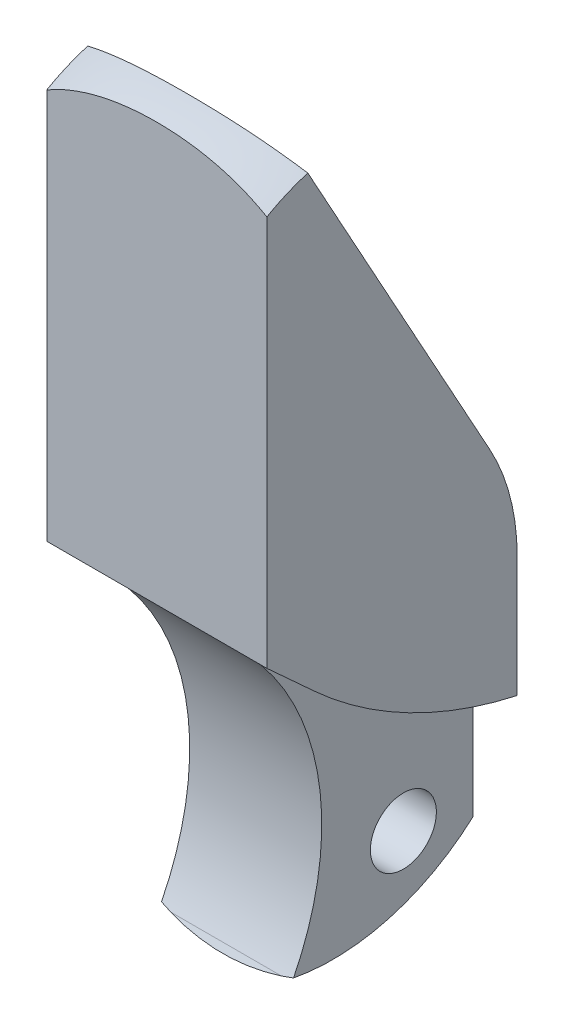
from build123d import *

# Parameters (mm, degrees)
SKETCH1_R           = 10
EXTRUDE1_DEPTH      = 35
FILLET1_R           = 10
FILLET_1_R          = 8
SKETCH2_W           = 7.672344266
SKETCH2_H           = 13.422166089
EXTRUDE2_DEPTH      = 20
SKETCH5_W           = 6.488658855
SKETCH5_H           = 20.959398048
EXTRUDE4_DEPTH      = 38.749172176
SKETCH7_W           = 24.373627343
SKETCH7_H           = 7.918162835
SKETCH7_H_2         = 6.543162835
EXTRUDE6_DEPTH      = 46
SKETCH10_R          = 1.5
CUT_EXTRUDE2_DEPTH  = 37.464237757
CUT_EXTRUDE3_DEPTH  = 37.954575301
FILLET2_START       = -3
FILLET2_OUTLINE_R   = 1.5
FILLET2_DEPTH       = 6
FILLET3_R           = 20
CUT_EXTRUDE_1_DEPTH = 37.954575301
FILLET_2_R          = 10


with BuildPart() as part:
    # Sketch1 → Extrude1 (new body)
    with BuildSketch(Plane(origin=(0, 0, 0), x_dir=(1, 0, 0), z_dir=(0, 1, 0))):
        with Locations(Location((0, 0, 0), (0, 0, 270))):
            Circle(SKETCH1_R)
    extrude(amount=EXTRUDE1_DEPTH)

    # Fillet1
    fillet1_edges = [part.edges().sort_by_distance(p)[0] for p in [
        (0, 0, -10),
    ]]
    fillet(fillet1_edges, radius=FILLET1_R)

    # Скругление1
    fillet_1_edges = [part.edges().sort_by_distance(p)[0] for p in [
        (0, 35, -10),
    ]]
    fillet(fillet_1_edges, radius=FILLET_1_R)

    # Sketch2 → Extrude2 (cut, symmetric)
    with BuildSketch(Plane.XY):
        with Locations((6.836172133, 1.953557325)):
            Rectangle(SKETCH2_W, SKETCH2_H)
        with Locations((-6.836172133, 1.953557325)):
            Rectangle(SKETCH2_W, SKETCH2_H)
    extrude(amount=EXTRUDE2_DEPTH, both=True, mode=Mode.SUBTRACT)

    # Sketch5 → Extrude4 (cut, through all)
    with BuildSketch(Plane(origin=(0, 0, 0), x_dir=(1, 0, 0), z_dir=(0, 1, 0))):
        with Locations((8.244329428, 0.450601309)):
            Rectangle(SKETCH5_W, SKETCH5_H)
        with Locations((-8.244329428, 0.450601309)):
            Rectangle(SKETCH5_W, SKETCH5_H)
    extrude(amount=EXTRUDE4_DEPTH, mode=Mode.SUBTRACT)

    # Sketch7 → Extrude6 (cut, symmetric)
    with BuildSketch(Plane(origin=(0, 0, 0), x_dir=(1, 0, 0), z_dir=(0, 1, 0))):
        with Locations((-0.125613483, -8.959081418)):
            Rectangle(SKETCH7_W, SKETCH7_H)
        with Locations((-0.125613483, 9.646581418)):
            Rectangle(SKETCH7_W, SKETCH7_H_2)
    extrude(amount=EXTRUDE6_DEPTH, both=True, mode=Mode.SUBTRACT)

    # Sketch10 → Cut-Extrude2 (cut, through all)
    with BuildSketch(Plane(origin=(3, 0, 0), x_dir=(0, 0, -1), z_dir=(1, 0, 0))):
        with Locations(Location((3.202782465, 3.918341245, 0), (0, 0, 90))):
            Circle(SKETCH10_R)
    extrude(amount=-CUT_EXTRUDE2_DEPTH, mode=Mode.SUBTRACT)

    # Sketch12 → Cut-Extrude3 (cut, through all)
    with BuildSketch(Plane(origin=(5, 0, 0), x_dir=(0, 0, -1), z_dir=(1, 0, 0))):
        Polygon((-5, 15.421884283), (2.380521482, 8.664640369), (-3.375305401, -2.43292564), (-5, -2.43292564), align=None)
    extrude(amount=-CUT_EXTRUDE3_DEPTH, mode=Mode.SUBTRACT)

    # Fillet2: read off the stored shape, not the designer's step
    # Fillet2 outline → Fillet2 (add)
    with BuildSketch(Plane.YZ.offset(FILLET2_START)):
        with BuildLine():
            ThreePointArc((0.62964824, 1.787878044), (0.810500421, -2.559901853), (2.903566036, -6.375))
            Line((2.903566036, -6.375), (8.664640369, -6.375))
            Line((8.664640369, -6.375), (8.664640369, -2.380521482))
            Line((8.664640369, -2.380521482), (14.875593683, 4.403320413))
            ThreePointArc((14.875593683, 4.403320413), (8.191715719, 0.703912056), (0.62964824, 1.787878044))
        make_face()
        with Locations((3.918341245, -3.202782465)):
            Circle(FILLET2_OUTLINE_R, mode=Mode.SUBTRACT)
    extrude(amount=FILLET2_DEPTH)

    # Fillet3
    # the kernel refuses this fillet: 20 mm, written as the material it takes off along each edge
    with BuildSketch(Plane(origin=(14.71184435, 8.664640369, -2.380521482), x_dir=(0, 0.6752773616828561, 0.7375638852320802), z_dir=(-1, 0, 0))) as fillet3_piece_1_section:
        with BuildLine():
            CenterArc((7.08473774, 20), FILLET3_R, 239.897661879, 30.102338121)
            Line((-2.946183095, 2.697380915), (-3.146801512, 2.351328533))
            ThreePointArc((-3.146801512, 2.351328533), (-1.743202492, 1.053664903), (-0.270110945, -0.295025554))
            Line((-0.270110945, -0.295025554), (0, -0.4))
            Line((0, -0.4), (7.08473774, -0.4))
            Line((7.08473774, -0.4), (7.08473774, 0))
        make_face()
    fillet3_piece_1 = extrude(amount=37.423688699, mode=Mode.PRIVATE)
    fillet3_piece_1 = split(fillet3_piece_1, bisect_by=Plane(origin=(3, 8.664640369, -2.380521482), z_dir=(1, 0, 0)), keep=Keep.TOP, mode=Mode.PRIVATE)
    add(fillet3_piece_1, mode=Mode.SUBTRACT)
    with BuildSketch(Plane(origin=(-3, 8.664640369, -2.380521482), x_dir=(0, 0.6752773616828561, 0.7375638852320802), z_dir=(-1, 0, 0)), Plane(origin=(22.71184435, 8.664640369, -2.380521482), x_dir=(0, 0.6752773616828562, 0.7375638852320802), z_dir=(-1, 0, 0))) as fillet3_piece_2:
        with BuildLine():
            CenterArc((7.08473774, 20), FILLET3_R, 239.897661879, 30.102338121)
            Line((-2.946183095, 2.697380915), (-3.146801512, 2.351328533))
            ThreePointArc((-3.146801512, 2.351328533), (-1.743202492, 1.053664903), (-0.270110945, -0.295025554))
            Line((-0.270110945, -0.295025554), (0, -0.4))
            Line((0, -0.4), (7.08473774, -0.4))
            Line((7.08473774, -0.4), (7.08473774, 0))
        make_face()
    extrude(amount=19.71184435, mode=Mode.SUBTRACT)
    with BuildSketch(Plane(origin=(22.71184435, 8.664640369, -2.380521482), x_dir=(0, 0.6752773616828562, 0.7375638852320802), z_dir=(-1, 0, 0))) as fillet3_piece_3_section:
        with BuildLine():
            CenterArc((7.08473774, 20), FILLET3_R, 239.897661879, 30.102338121)
            Line((-2.946183095, 2.697380915), (-3.146801512, 2.351328533))
            ThreePointArc((-3.146801512, 2.351328533), (-1.743202492, 1.053664903), (-0.270110945, -0.295025554))
            Line((-0.270110945, -0.295025554), (0, -0.4))
            Line((0, -0.4), (7.08473774, -0.4))
            Line((7.08473774, -0.4), (7.08473774, 0))
        make_face()
    fillet3_piece_3 = extrude(amount=37.423688699, mode=Mode.PRIVATE)
    fillet3_piece_3 = split(fillet3_piece_3, bisect_by=Plane(origin=(-3, 8.664640369, -2.380521482), z_dir=(-1, 0, 0)), keep=Keep.TOP, mode=Mode.PRIVATE)
    add(fillet3_piece_3, mode=Mode.SUBTRACT)

    # Эскиз1 → Вырез-Вытянуть1 (cut, through all)
    with BuildSketch(Plane(origin=(5, 0, 0), x_dir=(0, 0, -1), z_dir=(1, 0, 0))):
        Polygon((-4.197009704, 35.90598138), (7.773675874, 35.90598138), (7.773675874, 14.167506287), align=None)
    extrude(amount=-CUT_EXTRUDE_1_DEPTH, mode=Mode.SUBTRACT)

    # Скругление2
    fillet_2_edges = [part.edges().sort_by_distance(p)[0] for p in [
        (-1.1e-08, 16.707467799, -6.375),
    ]]
    fillet(fillet_2_edges, radius=FILLET_2_R)


solid = part.part
